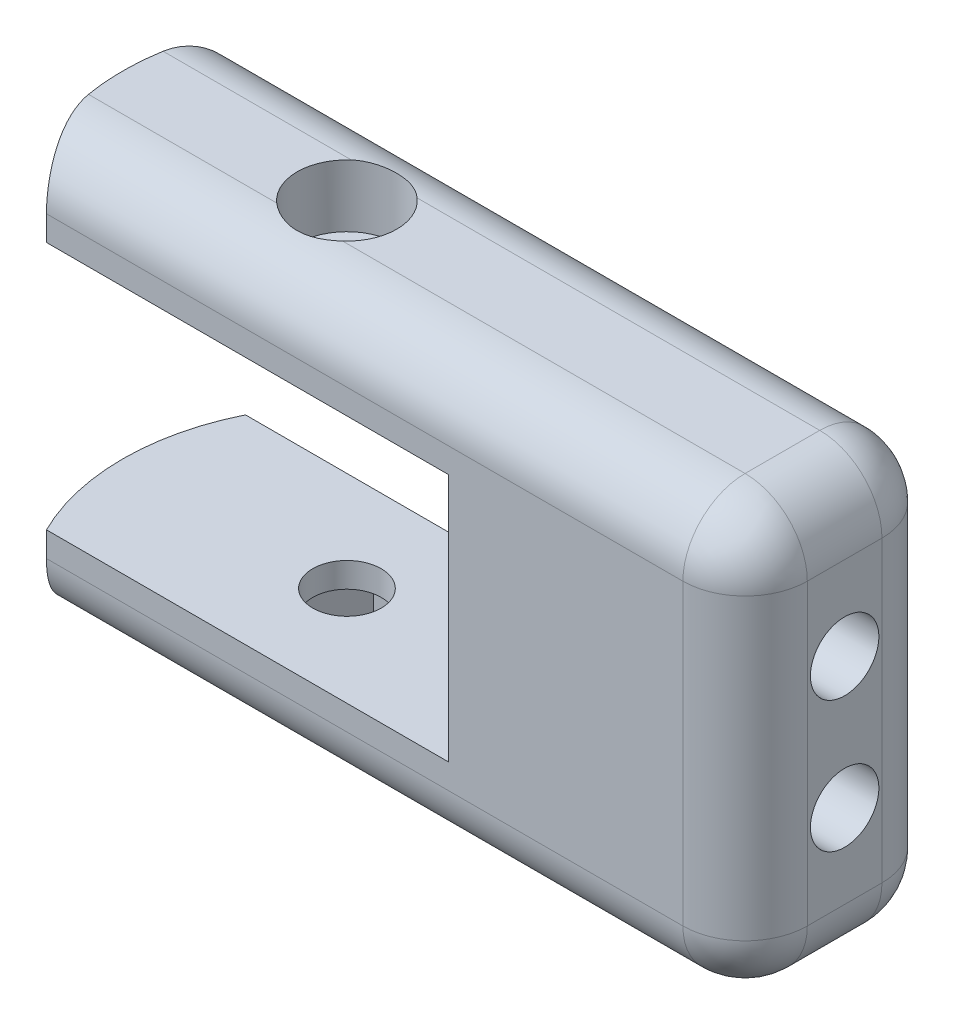
from build123d import *

# Parameters (mm, degrees)
ESQUISSE1_W             = 50
ESQUISSE1_H             = 34
BOSS_EXTRU_1_DEPTH      = 30
BOSS_EXTRU_2_DEPTH      = 7
ESQUISSE4_R             = 4
ENL_V_MAT_EXTRU_1_DEPTH = 5
ESQUISSE5_R             = 2.75
ENL_V_MAT_EXTRU_2_DEPTH = 66.122960621
ENL_V_MAT_EXTRU_3_DEPTH = 5
ESQUISSE7_R             = 2.75
ENL_V_MAT_EXTRU_4_DEPTH = 68.498148123
ESQUISSE8_R             = 4.5
ENL_V_MAT_EXTRU_5_DEPTH = 45
ESQUISSE9_W             = 20
ESQUISSE9_H             = 20
ENL_V_MAT_EXTRU_6_DEPTH = 68.498148123
ESQUISSE11_R            = 18.027756377
ENL_V_MAT_EXTRU_7_DEPTH = 20
ESQUISSE12_W            = 7
ESQUISSE12_H            = 34
ENL_V_MAT_EXTRU_8_DEPTH = 74.642518399
CONG_1_R                = 5


with BuildPart() as part:
    # Esquisse1 → Boss.-Extru.1 (new body)
    with BuildSketch(Plane.XY):
        with Locations((25, 17)):
            Rectangle(ESQUISSE1_W, ESQUISSE1_H)
    extrude(amount=BOSS_EXTRU_1_DEPTH)

    # Esquisse3 → Boss.-Extru.2 (add)
    with BuildSketch(Plane(origin=(0, 34, 0), x_dir=(1, 0, 0), z_dir=(0, 1, 0))):
        with BuildLine():
            Line((0, 0), (0, -30))
            ThreePointArc((0, -30), (-8.027756377, -15), (0, 0))
        make_face()
    boss_extru_2 = extrude(amount=-BOSS_EXTRU_2_DEPTH)

    # Symétrie1: Boss.-Extru.2 across plane
    add(boss_extru_2.mirror(Plane.ZX.offset(17)))

    # Esquisse4 → Enlèv. mat.-Extru.1 (cut)
    with BuildSketch(Plane(origin=(0, 34, 0), x_dir=(1, 0, 0), z_dir=(0, 1, 0))):
        with Locations(Location((10, -15, 0), (0, 0, 270))):
            Circle(ESQUISSE4_R)
    extrude(amount=-ENL_V_MAT_EXTRU_1_DEPTH, mode=Mode.SUBTRACT)

    # Esquisse5 → Enlèv. mat.-Extru.2 (cut, through all)
    with BuildSketch(Plane(origin=(0, 29, 0), x_dir=(1, 0, 0), z_dir=(0, 1, 0))):
        with Locations(Location((10, -15, 0), (0, 0, 270))):
            Circle(ESQUISSE5_R)
    extrude(amount=-ENL_V_MAT_EXTRU_2_DEPTH, mode=Mode.SUBTRACT)

    # Esquisse6 → Enlèv. mat.-Extru.3 (cut)
    with BuildSketch(Plane.XZ):
        Polygon((7.113248654, 20), (4.226497308, 15), (7.113248654, 10), (12.886751346, 10), (15.773502692, 15), (12.886751346, 20), align=None)
    extrude(amount=-ENL_V_MAT_EXTRU_3_DEPTH, mode=Mode.SUBTRACT)

    # Esquisse7 → Enlèv. mat.-Extru.4 (cut, through all)
    with BuildSketch(Plane.ZY):
        with Locations((15, 11.726702535)):
            Circle(ESQUISSE7_R)
        with Locations((15, 22.273297465)):
            Circle(ESQUISSE7_R)
    extrude(amount=-ENL_V_MAT_EXTRU_4_DEPTH, mode=Mode.SUBTRACT)

    # Esquisse8 → Enlèv. mat.-Extru.5 (cut)
    with BuildSketch(Plane.ZY):
        with Locations((15, 11.726702535)):
            Circle(ESQUISSE8_R)
        with Locations((15, 22.273297465)):
            Circle(ESQUISSE8_R)
    extrude(amount=-ENL_V_MAT_EXTRU_5_DEPTH, mode=Mode.SUBTRACT)

    # Esquisse9 → Enlèv. mat.-Extru.6 (cut, through all)
    with BuildSketch(Plane(origin=(0, 0, 0), x_dir=(-1, 0, 0), z_dir=(0, 0, -1))):
        with Locations((-10, 17)):
            Rectangle(ESQUISSE9_W, ESQUISSE9_H)
    extrude(amount=-ENL_V_MAT_EXTRU_6_DEPTH, mode=Mode.SUBTRACT)

    # Esquisse11 → Enlèv. mat.-Extru.7 (cut)
    with BuildSketch(Plane(origin=(0, 7, 0), x_dir=(1, 0, 0), z_dir=(0, 1, 0))):
        with Locations((10, -15)):
            Circle(ESQUISSE11_R)
    extrude(amount=ENL_V_MAT_EXTRU_7_DEPTH, mode=Mode.SUBTRACT)

    # Esquisse12 → Enlèv. mat.-Extru.8 (cut, through all)
    with BuildSketch(Plane(origin=(50, 0, 0), x_dir=(0, 0, -1), z_dir=(1, 0, 0))):
        with Locations((-3.5, 17)):
            Rectangle(ESQUISSE12_W, ESQUISSE12_H)
        with Locations((-26.5, 17)):
            Rectangle(ESQUISSE12_W, ESQUISSE12_H)
    extrude(amount=-ENL_V_MAT_EXTRU_8_DEPTH, mode=Mode.SUBTRACT)

    # Congé1
    # the kernel refuses this fillet: 5 mm, written as the material it takes off along each edge
    with BuildSketch(Plane(origin=(45, 5, 12), x_dir=(1, 0, 0), z_dir=(0, -1, 0))) as cong_1_piece_1_section:
        Polygon((0, 0), (CONG_1_R, 0), (CONG_1_R, -CONG_1_R), (0, -CONG_1_R), align=None)
    cong_1_piece_1 = extrude(amount=CONG_1_R, mode=Mode.PRIVATE)
    cong_1_piece_1 = cong_1_piece_1 - Plane(origin=(45, 5, 12), x_dir=(-0.7071067811865475, 0, 0.7071067811865475), z_dir=(0, -1, 0)) * Sphere(CONG_1_R, mode=Mode.PRIVATE)
    add(cong_1_piece_1, mode=Mode.SUBTRACT)
    with BuildSketch(Plane(origin=(45, 5, 18), x_dir=(1, 0, 0), z_dir=(0, -1, 0))) as cong_1_piece_2_section:
        Polygon((0, 0), (CONG_1_R, 0), (CONG_1_R, CONG_1_R), (0, CONG_1_R), align=None)
    cong_1_piece_2 = extrude(amount=CONG_1_R, mode=Mode.PRIVATE)
    cong_1_piece_2 = cong_1_piece_2 - Plane(origin=(45, 5, 18), x_dir=(-0.7071067811865475, 0, -0.7071067811865475), z_dir=(0, -1, 0)) * Sphere(CONG_1_R, mode=Mode.PRIVATE)
    add(cong_1_piece_2, mode=Mode.SUBTRACT)
    with BuildSketch(Plane(origin=(45, 29, 12), x_dir=(0, 1, 0), z_dir=(1, 0, 0))) as cong_1_piece_3_section:
        Polygon((0, 0), (CONG_1_R, 0), (CONG_1_R, -CONG_1_R), (0, -CONG_1_R), align=None)
    cong_1_piece_3 = extrude(amount=CONG_1_R, mode=Mode.PRIVATE)
    cong_1_piece_3 = cong_1_piece_3 - Plane(origin=(45, 29, 12), x_dir=(0, -0.7071067811865475, 0.7071067811865475), z_dir=(1, 0, 0)) * Sphere(CONG_1_R, mode=Mode.PRIVATE)
    add(cong_1_piece_3, mode=Mode.SUBTRACT)
    with BuildSketch(Plane(origin=(45, 29, 18), x_dir=(0, 0, 1), z_dir=(1, 0, 0))) as cong_1_piece_4_section:
        Polygon((0, 0), (CONG_1_R, 0), (CONG_1_R, -CONG_1_R), (0, -CONG_1_R), align=None)
    cong_1_piece_4 = extrude(amount=CONG_1_R, mode=Mode.PRIVATE)
    cong_1_piece_4 = cong_1_piece_4 - Plane(origin=(45, 29, 18), x_dir=(0, -0.7071067811865475, -0.7071067811865476), z_dir=(1, 0, 0)) * Sphere(CONG_1_R, mode=Mode.PRIVATE)
    add(cong_1_piece_4, mode=Mode.SUBTRACT)
    with BuildSketch(Plane(origin=(50, 0, 12), x_dir=(-1, 0, 0), z_dir=(0, 0, 1)), Plane(origin=(50, 34, 12), x_dir=(0, -1, 0), z_dir=(0, 0, 1))) as cong_1_piece_5:
        with BuildLine():
            CenterArc((CONG_1_R, -CONG_1_R), CONG_1_R, 90, 90)
            Line((0, -CONG_1_R), (0, 0))
            Line((0, 0), (CONG_1_R, 0))
        make_face()
    extrude(amount=6, mode=Mode.SUBTRACT)
    with BuildSketch(Plane(origin=(50, 29, 7), x_dir=(0, 0, 1), z_dir=(0, -1, 0))) as cong_1_piece_6:
        with BuildLine():
            CenterArc((CONG_1_R, CONG_1_R), CONG_1_R, 180, 90)
            Line((0, CONG_1_R), (0, 0))
            Line((0, 0), (CONG_1_R, 0))
        make_face()
    extrude(amount=24, mode=Mode.SUBTRACT)
    with BuildSketch(Plane(origin=(50, 29, 23), x_dir=(0, 0, -1), z_dir=(0, -1, 0))) as cong_1_piece_7:
        with BuildLine():
            CenterArc((CONG_1_R, -CONG_1_R), CONG_1_R, 90, 90)
            Line((0, -CONG_1_R), (0, 0))
            Line((0, 0), (CONG_1_R, 0))
        make_face()
    extrude(amount=24, mode=Mode.SUBTRACT)
    with BuildSketch(Plane(origin=(45, 34, 7), x_dir=(0, -1, 0), z_dir=(-1, 0, 0)), Plane(origin=(45, 0, 7), x_dir=(0, 0, 1), z_dir=(-1, 0, 0))) as cong_1_piece_8:
        with BuildLine():
            CenterArc((CONG_1_R, CONG_1_R), CONG_1_R, 180, 90)
            Line((0, CONG_1_R), (0, 0))
            Line((0, 0), (CONG_1_R, 0))
        make_face()
    extrude(amount=63.655494421, mode=Mode.SUBTRACT)
    with BuildSketch(Plane(origin=(45, 34, 23), x_dir=(0, -1, 0), z_dir=(-1, 0, 0)), Plane(origin=(45, 0, 23), x_dir=(0, 0, -1), z_dir=(-1, 0, 0))) as cong_1_piece_9:
        with BuildLine():
            CenterArc((CONG_1_R, -CONG_1_R), CONG_1_R, 90, 90)
            Line((0, -CONG_1_R), (0, 0))
            Line((0, 0), (CONG_1_R, 0))
        make_face()
    extrude(amount=63.655494421, mode=Mode.SUBTRACT)


solid = part.part
